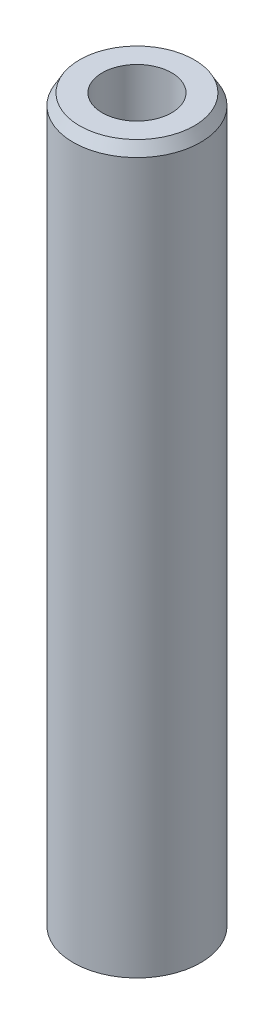
from build123d import *
from OCP.BRepFilletAPI import BRepFilletAPI_MakeChamfer

# Parameters (mm, degrees)
SKETCH1_R           = 10
BOSS_EXTRUDE1_DEPTH = 114.282805812
SKETCH2_R           = 5.449938827
CUT_EXTRUDE1_DEPTH  = 116.154503621
CHAMFER1_SIZE       = 1.742369764
CHAMFER1_SIZE2      = 1.005957652


with BuildPart() as part:
    # Sketch1 → Boss-Extrude1 (new body)
    with BuildSketch(Plane(origin=(0, 0, 0), x_dir=(1, 0, 0), z_dir=(0, 1, 0))):
        Circle(SKETCH1_R)
    extrude(amount=BOSS_EXTRUDE1_DEPTH)

    # Sketch2 → Cut-Extrude1 (cut, through all)
    with BuildSketch(Plane(origin=(0, 0, 0), x_dir=(1, 0, 0), z_dir=(0, 1, 0))):
        Circle(SKETCH2_R)
    extrude(amount=CUT_EXTRUDE1_DEPTH, mode=Mode.SUBTRACT)

    # Chamfer1: one chamfer whose edges measure the first distance from different faces: ONE call of the kernel's chamfer builder (chamfer() names one face for all edges)
    chamfer1_edges_1 = [part.edges().sort_by_distance(p)[0] for p in [
        (-10, 114.282805812, 0),
    ]]
    chamfer1_side_1 = [part.faces().sort_by_distance(p)[0] for p in [
        (-10, 57.141402906, 0),
    ]]
    chamfer1_edges_2 = [part.edges().sort_by_distance(p)[0] for p in [
        (-10, 0, 0),
    ]]
    chamfer1_side_2 = [part.faces().sort_by_distance(p)[0] for p in [
        (-9.717157288, 0, 0),
    ]]
    chamfer1 = BRepFilletAPI_MakeChamfer(part.part.solid().wrapped)
    for e in chamfer1_edges_1:
        chamfer1.Add(CHAMFER1_SIZE, CHAMFER1_SIZE2, e.wrapped, chamfer1_side_1[0].wrapped)  # the first distance lies on this face
    for e in chamfer1_edges_2:
        chamfer1.Add(CHAMFER1_SIZE, CHAMFER1_SIZE2, e.wrapped, chamfer1_side_2[0].wrapped)  # the first distance lies on this face
    add(Compound.cast(chamfer1.Shape()), mode=Mode.REPLACE)


solid = part.part
